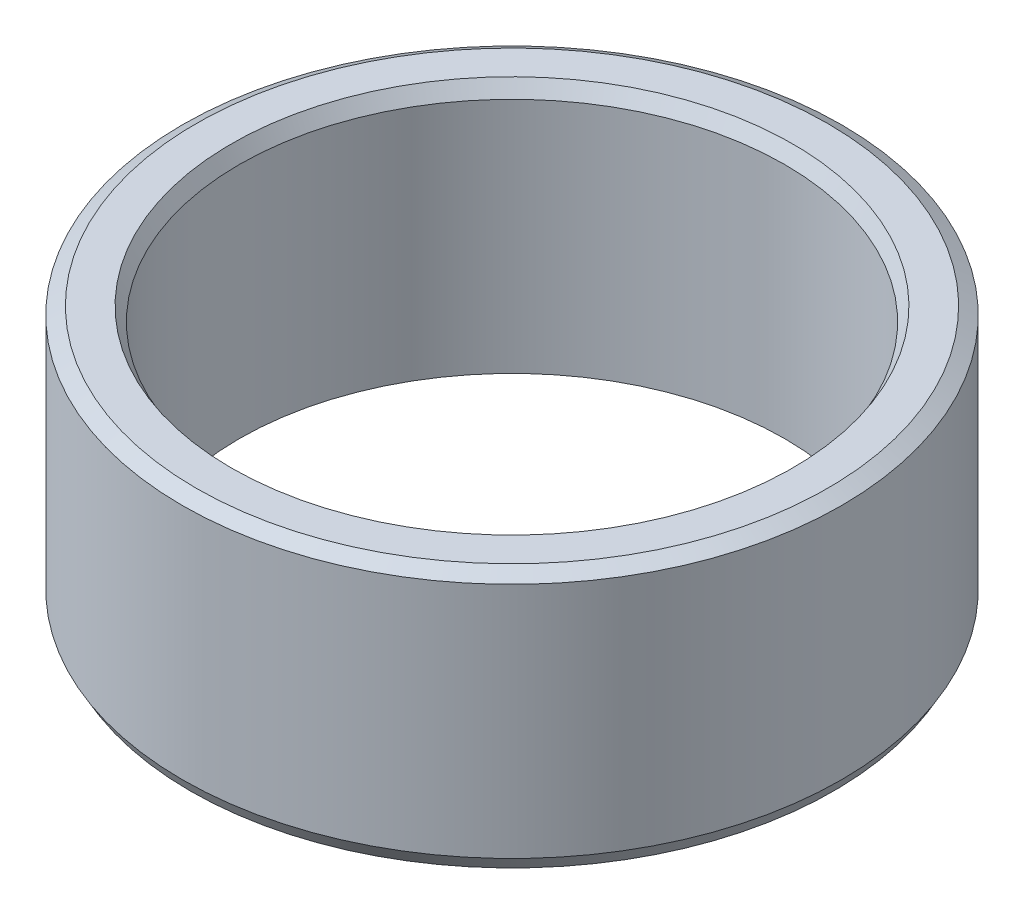
from build123d import *
from OCP.BRepFilletAPI import BRepFilletAPI_MakeChamfer

# Parameters (mm, degrees)
SKETCH1_R           = 52.5
BOSS_EXTRUDE1_DEPTH = 41.290386095
SKETCH2_R           = 43.421936527
CUT_EXTRUDE1_DEPTH  = 85.955258718
CHAMFER1_SIZE       = 1.275053892
CHAMFER1_SIZE2      = 2.208458123


with BuildPart() as part:
    # Sketch1 → Boss-Extrude1 (new body)
    with BuildSketch(Plane(origin=(0, 0, 0), x_dir=(1, 0, 0), z_dir=(0, 1, 0))):
        Circle(SKETCH1_R)
    extrude(amount=BOSS_EXTRUDE1_DEPTH)

    # Sketch2 → Cut-Extrude1 (cut, through all)
    with BuildSketch(Plane(origin=(0, 0, 0), x_dir=(1, 0, 0), z_dir=(0, 1, 0))):
        Circle(SKETCH2_R)
    extrude(amount=CUT_EXTRUDE1_DEPTH, mode=Mode.SUBTRACT)

    # Chamfer1: one chamfer whose edges measure the first distance from different faces: ONE call of the kernel's chamfer builder (chamfer() names one face for all edges)
    chamfer1_edges_1 = [part.edges().sort_by_distance(p)[0] for p in [
        (-43.421936527, 41.290386095, 0),
    ]]
    chamfer1_side_1 = [part.faces().sort_by_distance(p)[0] for p in [
        (-51.01507576, 41.290386095, 0),
    ]]
    chamfer1_edges_2 = [part.edges().sort_by_distance(p)[0] for p in [
        (-43.421936527, 0, 0),
    ]]
    chamfer1_side_2 = [part.faces().sort_by_distance(p)[0] for p in [
        (-43.421936527, 20.645193048, 0),
    ]]
    chamfer1_edges_3 = [part.edges().sort_by_distance(p)[0] for p in [
        (-52.5, 0, 0),
    ]]
    chamfer1_side_3 = [part.faces().sort_by_distance(p)[0] for p in [
        (-51.01507576, 0, 0),
    ]]
    chamfer1_edges_4 = [part.edges().sort_by_distance(p)[0] for p in [
        (-52.5, 41.290386095, 0),
    ]]
    chamfer1_side_4 = [part.faces().sort_by_distance(p)[0] for p in [
        (-52.5, 20.645193048, 0),
    ]]
    chamfer1 = BRepFilletAPI_MakeChamfer(part.part.solid().wrapped)
    for e in chamfer1_edges_1:
        chamfer1.Add(CHAMFER1_SIZE, CHAMFER1_SIZE2, e.wrapped, chamfer1_side_1[0].wrapped)  # the first distance lies on this face
    for e in chamfer1_edges_2:
        chamfer1.Add(CHAMFER1_SIZE, CHAMFER1_SIZE2, e.wrapped, chamfer1_side_2[0].wrapped)  # the first distance lies on this face
    for e in chamfer1_edges_3:
        chamfer1.Add(CHAMFER1_SIZE, CHAMFER1_SIZE2, e.wrapped, chamfer1_side_3[0].wrapped)  # the first distance lies on this face
    for e in chamfer1_edges_4:
        chamfer1.Add(CHAMFER1_SIZE, CHAMFER1_SIZE2, e.wrapped, chamfer1_side_4[0].wrapped)  # the first distance lies on this face
    add(Compound.cast(chamfer1.Shape()), mode=Mode.REPLACE)


solid = part.part
